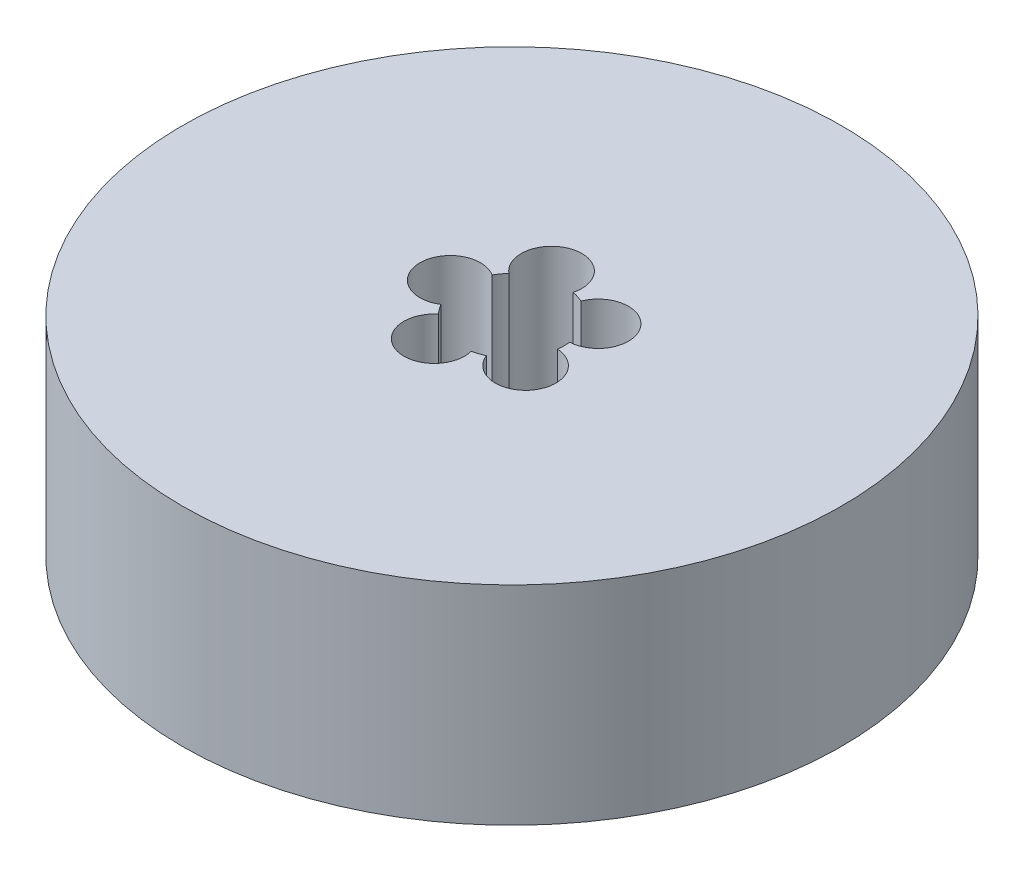
from build123d import *

# Parameters (mm, degrees)
SKETCH1_R           = 47.5
BOSS_EXTRUDE1_DEPTH = 30
SKETCH2_R           = 7.5
CUT_EXTRUDE1_DEPTH  = 74.569694848
SKETCH3_R           = 4.368899816
CUT_EXTRUDE2_DEPTH  = 26.813656841
CIRPATTERN1_COUNT   = 5


with BuildPart() as part:
    # Sketch1 → Boss-Extrude1 (new body)
    with BuildSketch(Plane(origin=(0, 0, 0), x_dir=(1, 0, 0), z_dir=(0, 1, 0))):
        Circle(SKETCH1_R)
    extrude(amount=BOSS_EXTRUDE1_DEPTH)

    # Sketch2 → Cut-Extrude1 (cut, through all)
    with BuildSketch(Plane(origin=(0, 0, 0), x_dir=(1, 0, 0), z_dir=(0, 1, 0))):
        Circle(SKETCH2_R)
    extrude(amount=CUT_EXTRUDE1_DEPTH, mode=Mode.SUBTRACT)

    # Sketch3 → Cut-Extrude2 (cut)
    with BuildSketch(Plane(origin=(0, 30, 0), x_dir=(1, 0, 0), z_dir=(0, 1, 0))):
        with Locations((-8.892401893, 0)):
            Circle(SKETCH3_R)
    cut_extrude2 = extrude(amount=-CUT_EXTRUDE2_DEPTH, mode=Mode.SUBTRACT)

    # CirPattern1: Cut-Extrude2 ×5 about axis
    cirpattern1_axis = Axis((0, 0, 0), (0, 1, 0))
    for i in range(1, CIRPATTERN1_COUNT):
        add(cut_extrude2.rotate(cirpattern1_axis, i * 360 / CIRPATTERN1_COUNT), mode=Mode.SUBTRACT)


solid = part.part
